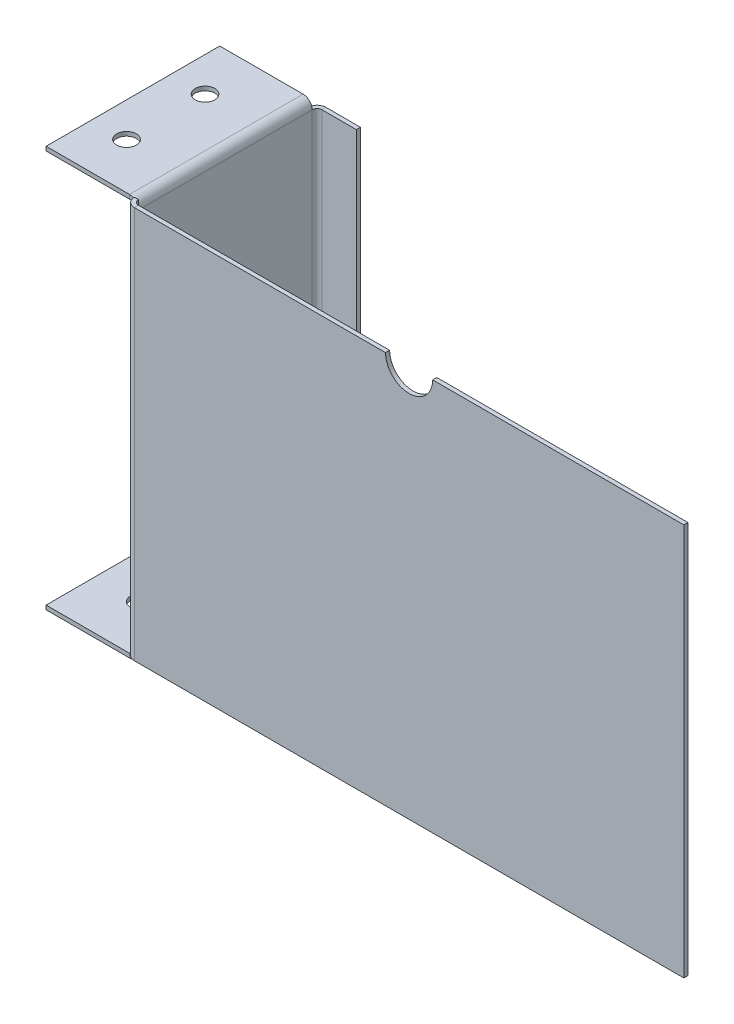
from build123d import *

# Parameters (mm, degrees)
BASE_FLANGE1_DEPTH           = 2.65684
EDGE_FLANGE1_DEPTH           = 254
EDGE_FLANGE2_STRIP_W         = 16.97736
EDGE_FLANGE2_STRIP_H         = 2.65684
EDGE_FLANGE2_STRIP_CUT_DEPTH = 112.395
EDGE_FLANGE2_DEPTH           = 112.395
EDGE_FLANGE3_DEPTH           = 112.395
EDGE_FLANGE4_DEPTH           = 248.16816
SKETCH23_R                   = 6.35
CUT_EXTRUDE1_DEPTH           = 2.65684
SKETCH24_R                   = 6.35
CUT_EXTRUDE2_DEPTH           = 2.65684
SKETCH27_R                   = 6.35
CUT_EXTRUDE3_DEPTH           = 2.65684


# Sheet-metal steps are written as plain solids
with BuildPart() as part:
    # Sketch1 → Base-Flange1 (new body)
    with BuildSketch(Plane.XY):
        with BuildLine():
            Line((193.04, 254), (355.6, 254))
            Line((355.6, 254), (355.6, 0))
            Line((355.6, 0), (0, 0))
            Line((0, 0), (0, 254))
            Line((0, 254), (162.56, 254))
            ThreePointArc((162.56, 254), (177.8, 238.76), (193.04, 254))
        make_face()
    extrude(amount=-BASE_FLANGE1_DEPTH)

    # Edge-Flange1 section (across the edge) → Edge-Flange1 (add)
    with BuildSketch(Plane(origin=(-3.175, 0, -2.65684), x_dir=(1, 0, 0), z_dir=(0, 1, 0))):
        with BuildLine():
            Line((-2.65684, 3.175), (-2.65684, 115.57))
            Line((-2.65684, 115.57), (0, 115.57))
            Line((0, 115.57), (0, 3.175))
            ThreePointArc((0, 3.175), (0.92993597, 0.92993597), (3.175, 0))
            Line((3.175, 0), (3.175, -2.65684))
            ThreePointArc((3.175, -2.65684), (-0.948733611, -0.948733611), (-2.65684, 3.175))
        make_face()
    extrude(amount=EDGE_FLANGE1_DEPTH)

    # Edge-Flange2 strip (across the edge) → Edge-Flange2 strip cut (cut)
    with BuildSketch(Plane(origin=(-5.83184, 254, -5.83184), x_dir=(0, -1, 0), z_dir=(0, 0, -1))):
        with Locations((-2.65684, -1.32842)):
            Rectangle(EDGE_FLANGE2_STRIP_W, EDGE_FLANGE2_STRIP_H)
    extrude(amount=EDGE_FLANGE2_STRIP_CUT_DEPTH, mode=Mode.SUBTRACT)

    # Edge-Flange2 section (across the edge) → Edge-Flange2 (add)
    with BuildSketch(Plane(origin=(-5.83184, 254, -5.83184), x_dir=(0, -1, 0), z_dir=(0, 0, -1))):
        with BuildLine():
            Line((0, 3.175), (0, 57.15))
            Line((0, 57.15), (2.65684, 57.15))
            Line((2.65684, 57.15), (2.65684, 3.175))
            ThreePointArc((2.65684, 3.175), (3.58677597, 0.92993597), (5.83184, 0))
            Line((5.83184, 0), (5.83184, -2.65684))
            ThreePointArc((5.83184, -2.65684), (1.708106389, -0.948733611), (0, 3.175))
        make_face()
    extrude(amount=EDGE_FLANGE2_DEPTH)

    # Edge-Flange3 section (across the edge) → Edge-Flange3 (add)
    with BuildSketch(Plane(origin=(-5.83184, -3.175, -118.22684), x_dir=(0, 1, 0), z_dir=(0, 0, 1))):
        with BuildLine():
            Line((-2.65684, 3.175), (-2.65684, 57.15))
            Line((-2.65684, 57.15), (0, 57.15))
            Line((0, 57.15), (0, 3.175))
            ThreePointArc((0, 3.175), (0.92993597, 0.92993597), (3.175, 0))
            Line((3.175, 0), (3.175, -2.65684))
            ThreePointArc((3.175, -2.65684), (-0.948733611, -0.948733611), (-2.65684, 3.175))
        make_face()
    extrude(amount=EDGE_FLANGE3_DEPTH)

    # Edge-Flange4 section (across the edge) → Edge-Flange4 (add)
    with BuildSketch(Plane(origin=(-3.175, 0, -121.40184), x_dir=(0, 0, 1), z_dir=(0, 1, 0))):
        with BuildLine():
            Line((-2.65684, 3.175), (-2.65684, 25.4))
            Line((-2.65684, 25.4), (0, 25.4))
            Line((0, 25.4), (0, 3.175))
            ThreePointArc((0, 3.175), (0.92993597, 0.92993597), (3.175, 0))
            Line((3.175, 0), (3.175, -2.65684))
            ThreePointArc((3.175, -2.65684), (-0.948733611, -0.948733611), (-2.65684, 3.175))
        make_face()
    extrude(amount=EDGE_FLANGE4_DEPTH)

    # Sketch23 → Cut-Extrude1 (cut)
    with BuildSketch(Plane(origin=(0, 254, 0), x_dir=(1, 0, 0), z_dir=(0, 1, 0))):
        with Locations(Location((-40.76446, 86.47684, 0), (0, 0, 180))):
            Circle(SKETCH23_R)
        with Locations(Location((-40.76446, 35.67684, 0), (0, 0, 180))):
            Circle(SKETCH23_R)
    extrude(amount=-CUT_EXTRUDE1_DEPTH, mode=Mode.SUBTRACT)

    # Sketch24 → Cut-Extrude2 (cut)
    with BuildSketch(Plane(origin=(0, -3.175, 0), x_dir=(1, 0, 0), z_dir=(0, 1, 0))):
        with Locations(Location((-34.40684, 82.66684, 0), (0, 0, 180))):
            Circle(SKETCH24_R)
        with Locations(Location((-34.40684, 38.21684, 0), (0, 0, 180))):
            Circle(SKETCH24_R)
    extrude(amount=-CUT_EXTRUDE2_DEPTH, mode=Mode.SUBTRACT)

    # Sketch27 → Cut-Extrude3 (cut)
    with BuildSketch(Plane.ZY.offset(5.83184)):
        with Locations((-86.77656, 41.79316)):
            Circle(SKETCH27_R)
        with Locations((-34.1884, 41.79316)):
            Circle(SKETCH27_R)
    extrude(amount=-CUT_EXTRUDE3_DEPTH, mode=Mode.SUBTRACT)


solid = part.part
